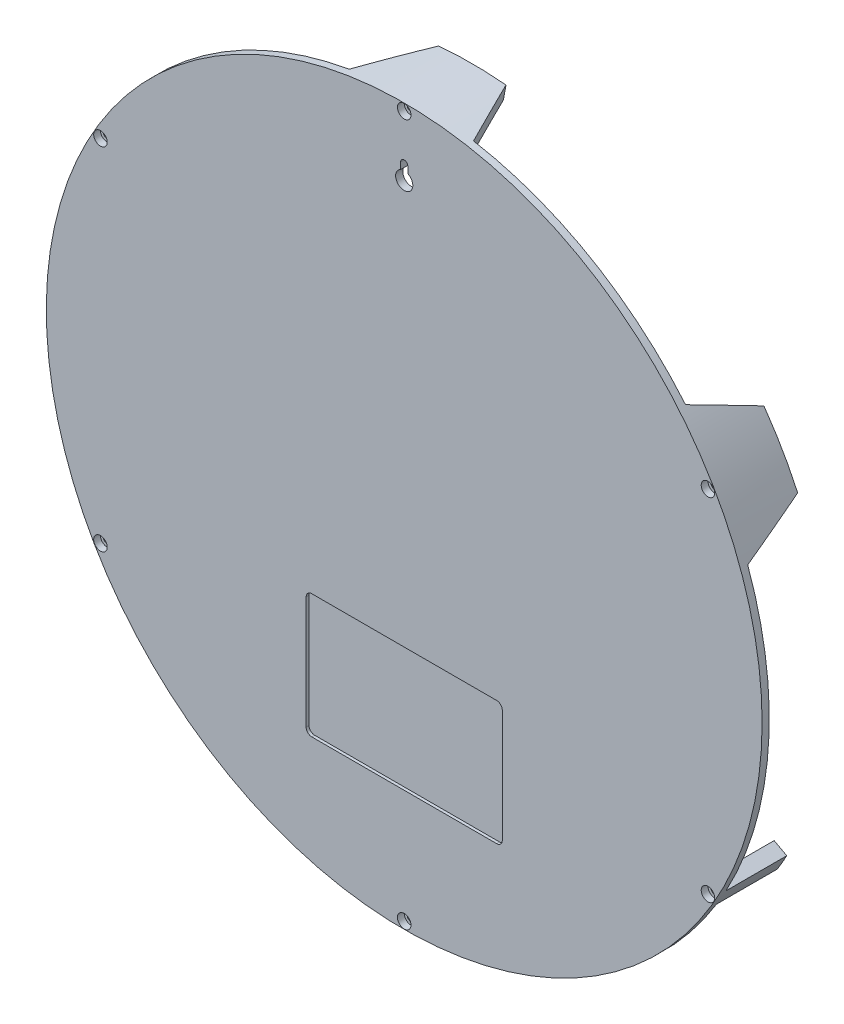
from build123d import *
from OCP.BRepFilletAPI import BRepFilletAPI_MakeChamfer
from build123d.topology import SkipClean

# Parameters (mm, degrees)
SKETCH1_R                      = 158.75
BOSS_EXTRUDE1_DEPTH            = 3.175
BOSS_EXTRUDE2_START            = 26.9875
BOSS_EXTRUDE2_DEPTH            = 26.9875
CHAMFER1_SIZE                  = 26.9875
CHAMFER1_SIZE_2                = 12.7
CBORE_FOR_M3_SHCS1_D           = 3.4
CBORE_FOR_M3_SHCS1_CBORE_D     = 6
CBORE_FOR_M3_SHCS1_CBORE_DEPTH = 3
CIRPATTERN1_COUNT              = 6
CHAMFER1_OF_CIRPATTERN1_SIZE   = 26.9875
CHAMFER1_OF_CIRPATTERN1_SIZE_2 = 12.7
CUT_EXTRUDE1_DEPTH             = 3.175
SKETCH8_W                      = 86
SKETCH8_H                      = 54
CUT_EXTRUDE2_DEPTH             = 1.27
FILLET1_R                      = 2
CUT_EXTRUDE4_DEPTH             = 1.27
CUT_EXTRUDE3_DEPTH             = 26.9875
BOSS_EXTRUDE3_DEPTH            = 3.175
CHAMFER2_SIZE                  = 2


with BuildPart() as part:
    # Sketch1 → Boss-Extrude1 (new body)
    with BuildSketch(Plane.XY):
        Circle(SKETCH1_R)
    extrude(amount=BOSS_EXTRUDE1_DEPTH)

    # Sketch9 → Boss-Extrude2 (add)
    with SkipClean():  # the faces are left unmerged after this step: merging them gives an invalid solid
        with BuildSketch(Plane(origin=(0, 0, 0), x_dir=(-1, 0, 0), z_dir=(0, 0, -1)).offset(BOSS_EXTRUDE2_START)):
            with BuildLine():
                Line((-27.566648205, 156.338230791), (-26.463982276, 150.084701559))
                ThreePointArc((-26.463982276, 150.084701559), (0, 152.4), (26.463982276, 150.084701559))
                Line((26.463982276, 150.084701559), (27.566648205, 156.338230791))
                ThreePointArc((27.566648205, 156.338230791), (0, 158.75), (-27.566648205, 156.338230791))
            make_face()
        boss_extrude2 = extrude(amount=-BOSS_EXTRUDE2_DEPTH)

    # Chamfer1
    chamfer1_edges_1 = [part.edges().sort_by_distance(p)[0] for p in [
        (27.015315241, 153.211466175, -26.9875),
    ]]
    chamfer1_side_1 = [part.faces().sort_by_distance(p)[0] for p in [
        (27.015315241, 153.211466175, -26.7335),
    ]]
    chamfer1_edges_2 = [part.edges().sort_by_distance(p)[0] for p in [
        (-27.015315241, 153.211466175, -26.9875),
    ]]
    chamfer1_side_2 = [part.faces().sort_by_distance(p)[0] for p in [
        (-27.015315241, 153.211466175, -26.7335),
    ]]
    chamfer1 = BRepFilletAPI_MakeChamfer(part.part.solid().wrapped)
    for e in chamfer1_edges_1:
        chamfer1.Add(CHAMFER1_SIZE - 0.0001, CHAMFER1_SIZE_2 - 0.0001, e.wrapped, chamfer1_side_1[0].wrapped)
    for e in chamfer1_edges_2:
        chamfer1.Add(CHAMFER1_SIZE - 0.0001, CHAMFER1_SIZE_2 - 0.0001, e.wrapped, chamfer1_side_2[0].wrapped)
    add(Compound.cast(chamfer1.Shape()), mode=Mode.REPLACE)  # a hair under: the kernel refuses the full size

    # CBORE for M3 SHCS1 (through all)
    with Locations(Plane.XY.offset(3.175)):
        with Locations((0, 155.575)):
            cbore_for_m3_shcs1 = CounterBoreHole(CBORE_FOR_M3_SHCS1_D / 2, CBORE_FOR_M3_SHCS1_CBORE_D / 2, CBORE_FOR_M3_SHCS1_CBORE_DEPTH)

    # CirPattern1: Boss-Extrude2, CBORE for M3 SHCS1 ×6 about axis
    cirpattern1_axis = Axis((0, 0, 0), (0, 0, 1))
    add([boss_extrude2.rotate(cirpattern1_axis, i * 360 / CIRPATTERN1_COUNT) for i in range(1, CIRPATTERN1_COUNT)])
    add([cbore_for_m3_shcs1.rotate(cirpattern1_axis, i * 360 / CIRPATTERN1_COUNT) for i in range(1, CIRPATTERN1_COUNT)], mode=Mode.SUBTRACT)

    # Chamfer1 of CirPattern1
    chamfer1_of_cirpattern1_edges_1 = [part.edges().sort_by_distance(p)[0] for p in [
        (-119.177364238, 100.001682377, -26.9875),
    ]]
    chamfer1_of_cirpattern1_side_1 = [part.faces().sort_by_distance(p)[0] for p in [
        (-119.177364238, 100.001682377, -26.7335),
    ]]
    chamfer1_of_cirpattern1_edges_2 = [part.edges().sort_by_distance(p)[0] for p in [
        (-146.192679479, 53.209783798, -26.9875),
    ]]
    chamfer1_of_cirpattern1_side_2 = [part.faces().sort_by_distance(p)[0] for p in [
        (-146.192679479, 53.209783798, -26.7335),
    ]]
    chamfer1_of_cirpattern1_edges_3 = [part.edges().sort_by_distance(p)[0] for p in [
        (-146.192679479, -53.209783798, -26.9875),
    ]]
    chamfer1_of_cirpattern1_side_3 = [part.faces().sort_by_distance(p)[0] for p in [
        (-146.192679479, -53.209783798, -26.7335),
    ]]
    chamfer1_of_cirpattern1_edges_4 = [part.edges().sort_by_distance(p)[0] for p in [
        (-119.177364238, -100.001682377, -26.9875),
    ]]
    chamfer1_of_cirpattern1_side_4 = [part.faces().sort_by_distance(p)[0] for p in [
        (-119.177364238, -100.001682377, -26.7335),
    ]]
    chamfer1_of_cirpattern1_edges_5 = [part.edges().sort_by_distance(p)[0] for p in [
        (-27.015315241, -153.211466175, -26.9875),
    ]]
    chamfer1_of_cirpattern1_side_5 = [part.faces().sort_by_distance(p)[0] for p in [
        (-27.015315241, -153.211466175, -26.7335),
    ]]
    chamfer1_of_cirpattern1_edges_6 = [part.edges().sort_by_distance(p)[0] for p in [
        (27.015315241, -153.211466175, -26.9875),
    ]]
    chamfer1_of_cirpattern1_side_6 = [part.faces().sort_by_distance(p)[0] for p in [
        (27.015315241, -153.211466175, -26.7335),
    ]]
    chamfer1_of_cirpattern1_edges_7 = [part.edges().sort_by_distance(p)[0] for p in [
        (119.177364238, -100.001682377, -26.9875),
    ]]
    chamfer1_of_cirpattern1_side_7 = [part.faces().sort_by_distance(p)[0] for p in [
        (119.177364238, -100.001682377, -26.7335),
    ]]
    chamfer1_of_cirpattern1_edges_8 = [part.edges().sort_by_distance(p)[0] for p in [
        (146.192679479, -53.209783798, -26.9875),
    ]]
    chamfer1_of_cirpattern1_side_8 = [part.faces().sort_by_distance(p)[0] for p in [
        (146.105806362, -53.448465724, -26.9875),
    ]]
    chamfer1_of_cirpattern1_edges_9 = [part.edges().sort_by_distance(p)[0] for p in [
        (146.192679479, 53.209783798, -26.9875),
    ]]
    chamfer1_of_cirpattern1_side_9 = [part.faces().sort_by_distance(p)[0] for p in [
        (146.192679479, 53.209783798, -26.7335),
    ]]
    chamfer1_of_cirpattern1_edges_10 = [part.edges().sort_by_distance(p)[0] for p in [
        (119.177364238, 100.001682377, -26.9875),
    ]]
    chamfer1_of_cirpattern1_side_10 = [part.faces().sort_by_distance(p)[0] for p in [
        (119.177364238, 100.001682377, -26.7335),
    ]]
    chamfer1_of_cirpattern1 = BRepFilletAPI_MakeChamfer(part.part.solid().wrapped)
    for e in chamfer1_of_cirpattern1_edges_1:
        chamfer1_of_cirpattern1.Add(CHAMFER1_OF_CIRPATTERN1_SIZE - 0.0001, CHAMFER1_OF_CIRPATTERN1_SIZE_2 - 0.0001, e.wrapped, chamfer1_of_cirpattern1_side_1[0].wrapped)
    for e in chamfer1_of_cirpattern1_edges_2:
        chamfer1_of_cirpattern1.Add(CHAMFER1_OF_CIRPATTERN1_SIZE - 0.0001, CHAMFER1_OF_CIRPATTERN1_SIZE_2 - 0.0001, e.wrapped, chamfer1_of_cirpattern1_side_2[0].wrapped)
    for e in chamfer1_of_cirpattern1_edges_3:
        chamfer1_of_cirpattern1.Add(CHAMFER1_OF_CIRPATTERN1_SIZE - 0.0001, CHAMFER1_OF_CIRPATTERN1_SIZE_2 - 0.0001, e.wrapped, chamfer1_of_cirpattern1_side_3[0].wrapped)
    for e in chamfer1_of_cirpattern1_edges_4:
        chamfer1_of_cirpattern1.Add(CHAMFER1_OF_CIRPATTERN1_SIZE - 0.0001, CHAMFER1_OF_CIRPATTERN1_SIZE_2 - 0.0001, e.wrapped, chamfer1_of_cirpattern1_side_4[0].wrapped)
    for e in chamfer1_of_cirpattern1_edges_5:
        chamfer1_of_cirpattern1.Add(CHAMFER1_OF_CIRPATTERN1_SIZE - 0.0001, CHAMFER1_OF_CIRPATTERN1_SIZE_2 - 0.0001, e.wrapped, chamfer1_of_cirpattern1_side_5[0].wrapped)
    for e in chamfer1_of_cirpattern1_edges_6:
        chamfer1_of_cirpattern1.Add(CHAMFER1_OF_CIRPATTERN1_SIZE - 0.0001, CHAMFER1_OF_CIRPATTERN1_SIZE_2 - 0.0001, e.wrapped, chamfer1_of_cirpattern1_side_6[0].wrapped)
    for e in chamfer1_of_cirpattern1_edges_7:
        chamfer1_of_cirpattern1.Add(CHAMFER1_OF_CIRPATTERN1_SIZE - 0.0001, CHAMFER1_OF_CIRPATTERN1_SIZE_2 - 0.0001, e.wrapped, chamfer1_of_cirpattern1_side_7[0].wrapped)
    for e in chamfer1_of_cirpattern1_edges_8:
        chamfer1_of_cirpattern1.Add(CHAMFER1_OF_CIRPATTERN1_SIZE_2 - 0.0001, CHAMFER1_OF_CIRPATTERN1_SIZE - 0.0001, e.wrapped, chamfer1_of_cirpattern1_side_8[0].wrapped)
    for e in chamfer1_of_cirpattern1_edges_9:
        chamfer1_of_cirpattern1.Add(CHAMFER1_OF_CIRPATTERN1_SIZE - 0.0001, CHAMFER1_OF_CIRPATTERN1_SIZE_2 - 0.0001, e.wrapped, chamfer1_of_cirpattern1_side_9[0].wrapped)
    for e in chamfer1_of_cirpattern1_edges_10:
        chamfer1_of_cirpattern1.Add(CHAMFER1_OF_CIRPATTERN1_SIZE - 0.0001, CHAMFER1_OF_CIRPATTERN1_SIZE_2 - 0.0001, e.wrapped, chamfer1_of_cirpattern1_side_10[0].wrapped)
    add(Compound.cast(chamfer1_of_cirpattern1.Shape()), mode=Mode.REPLACE)  # a hair under: the kernel refuses the full size

    # Sketch7 → Cut-Extrude1 (cut)
    with BuildSketch(Plane.XY.offset(3.175)):
        with BuildLine():
            Line((-1.5875, 132.368516096), (-1.5875, 135.255))
            ThreePointArc((-1.5875, 135.255), (0, 136.8425), (1.5875, 135.255))
            Line((1.5875, 135.255), (1.5875, 132.368516096))
            ThreePointArc((1.5875, 132.368516096), (0, 125.095), (-1.5875, 132.368516096))
        make_face()
    extrude(amount=-CUT_EXTRUDE1_DEPTH, mode=Mode.SUBTRACT)

    # Sketch8 → Cut-Extrude2 (cut)
    with BuildSketch(Plane.XY.offset(3.175)):
        with Locations((0, -77.775)):
            Rectangle(SKETCH8_W, SKETCH8_H)
    extrude(amount=-CUT_EXTRUDE2_DEPTH, mode=Mode.SUBTRACT)

    # Fillet1
    fillet1_edges = [part.edges().sort_by_distance(p)[0] for p in [
        (-43, -104.775, 2.54),
        (-43, -50.775, 2.54),
        (43, -50.775, 2.54),
        (43, -104.775, 2.54),
    ]]
    fillet(fillet1_edges, radius=FILLET1_R)

    # Sketch13 → Cut-Extrude4 (cut)
    with BuildSketch(Plane.XY.offset(3.175)):
        with BuildLine():
            Line((-43.5, -52.775), (-43.5, -102.775))
            ThreePointArc((-43.5, -102.775), (-42.767766953, -104.542766953), (-41, -105.275))
            Line((-41, -105.275), (41, -105.275))
            ThreePointArc((41, -105.275), (42.767766953, -104.542766953), (43.5, -102.775))
            Line((43.5, -102.775), (43.5, -52.775))
            ThreePointArc((43.5, -52.775), (42.767766953, -51.007233047), (41, -50.275))
            Line((41, -50.275), (-41, -50.275))
            ThreePointArc((-41, -50.275), (-42.767766953, -51.007233047), (-43.5, -52.775))
        make_face()
    extrude(amount=-CUT_EXTRUDE4_DEPTH, mode=Mode.SUBTRACT)

    # Sketch10 → Cut-Extrude3 (cut)
    with BuildSketch(Plane(origin=(0, 0, -26.9875), x_dir=(-1, 0, 0), z_dir=(0, 0, -1))):
        with BuildLine():
            ThreePointArc((-144.354417642, -66.055768917), (-142.016041239, -70.943685629), (-139.512216635, -75.748953191))
            Line((-139.512216635, -75.748953191), (-133.93172797, -72.718995064))
            ThreePointArc((-133.93172797, -72.718995064), (-136.221318638, -68.333830192), (-138.367379277, -63.876665161))
            Line((-138.367379277, -63.876665161), (-144.354417642, -66.055768917))
        make_face()
        with BuildLine():
            Line((-129.942361048, -79.628781263), (-135.356626091, -82.946647149))
            ThreePointArc((-135.356626091, -82.946647149), (-132.447054613, -87.517656643), (-129.38318277, -91.986708368))
            Line((-129.38318277, -91.986708368), (-124.502504377, -87.891332929))
            ThreePointArc((-124.502504377, -87.891332929), (-127.289492203, -83.804207381), (-129.942361048, -79.628781263))
        make_face()
        with BuildLine():
            ThreePointArc((-149.17620355, -54.295697753), (-146.883052844, -60.224009226), (-144.354417642, -66.055768917))
            Line((-144.354417642, -66.055768917), (-138.367379277, -63.876665161))
            ThreePointArc((-138.367379277, -63.876665161), (-140.910852211, -58.05076855), (-143.209155408, -52.123869843))
            Line((-143.209155408, -52.123869843), (-149.17620355, -54.295697753))
        make_face()
        with BuildLine():
            Line((-124.502504377, -87.891332929), (-129.38318277, -91.986708368))
            ThreePointArc((-129.38318277, -91.986708368), (-125.597048329, -97.092450535), (-121.609555345, -102.042533038))
            Line((-121.609555345, -102.042533038), (-116.745173131, -97.960831716))
            ThreePointArc((-116.745173131, -97.960831716), (-120.728866379, -93.006993408), (-124.502504377, -87.891332929))
        make_face()
    extrude(amount=-CUT_EXTRUDE3_DEPTH, mode=Mode.SUBTRACT)

    # Sketch11 → Boss-Extrude3 (add, symmetric)
    with BuildSketch(Plane(origin=(0, 0, 0), x_dir=(0, 0, -1), z_dir=(1, 0, 0))):
        Polygon((26.9875, 152.4), (0, 152.4), (0, 139.7), align=None)
    extrude(amount=BOSS_EXTRUDE3_DEPTH, both=True)

    # Chamfer2
    chamfer2_edges = [part.edges().sort_by_distance(p)[0] for p in [
        (131.982271537, -76.2, 0),
        (0, -152.4, 0),
        (-131.982271537, -76.2, 0),
        (-131.982271537, 76.2, 0),
        (-14.863359372, 151.673466856, 0),
        (14.863359372, 151.673466856, 0),
        (131.982271537, 76.2, 0),
    ]]
    chamfer(chamfer2_edges, length=CHAMFER2_SIZE)


solid = part.part
